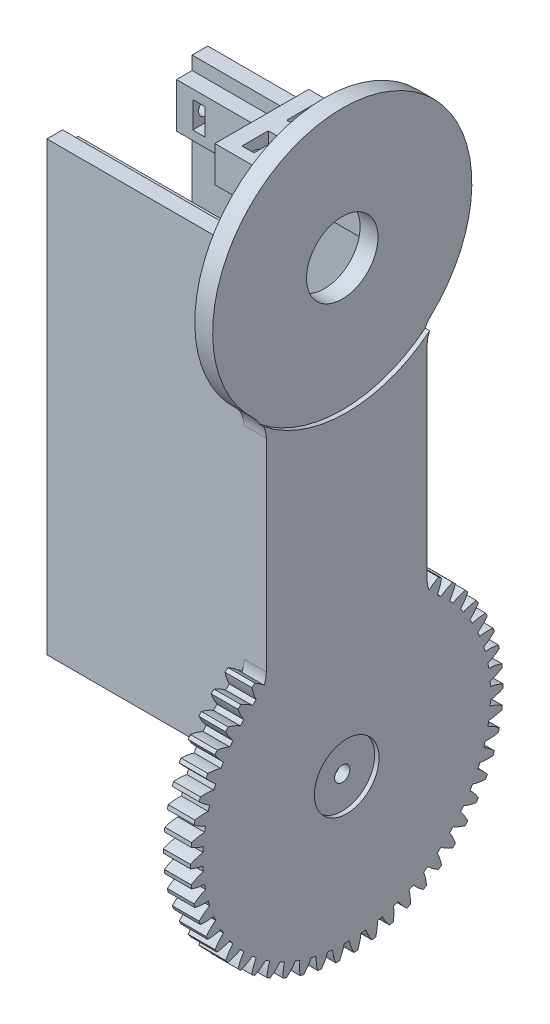
from build123d import *

# Parameters (mm, degrees)
PLATE_START                   = 22.05
SKETCH1_R                     = 8
PLATE_A_DEPTH                 = 5
SHOULDER_START                = 21.05
SHOULDER_GEAR_54T_M1_25_DEPTH = 6
BOX_START                     = -22.05
SKETCH3_W                     = 3.5
SKETCH3_H                     = 100
BOX_WALLS_DEPTH               = 44.3
WALL_START                    = -22.05
SKETCH4_W                     = 3.5
SKETCH4_H                     = 10
WALL_BOSSES_DEPTH             = 44.3
ELBOW_START                   = 8.05
SKETCH5_W                     = 21
SKETCH5_H                     = 8
ELBOW_SERVO_LEDGES_DEPTH      = 14.2
SHOULDER_START_2              = 26.05
SKETCH6_R                     = 7.25
SHOULDER_PIN_SEAT_DEPTH       = 1.2
SHOULDER_START_3              = 20.85
SKETCH7_R                     = 1.7
SHOULDER_PIN_BOLT_DEPTH       = 6.4
SHOULDER_PIN_NUT_DEPTH        = 2.9
ELBOW_START_2                 = 26.05
SKETCH9_R                     = 29.5
ELBOW_HORN_CLEARANCE_DEPTH    = 1.2
COVER_START                   = -22.25
SKETCH10_R                    = 1.7
COVER_BOLT_HOLES_DEPTH        = 10.2
COVER_START_2                 = -18.4
COVER_NUT_SLOTS_DEPTH         = 2.7
TAB_START                     = 7.85
SKETCH12_R                    = 1.7
TAB_BOLT_HOLES_DEPTH          = 9.2
TAB_START_2                   = 11.55
TAB_NUT_SLOTS_DEPTH           = 2.7


with BuildPart() as part:
    # Sketch1 → Plate A (new body)
    with BuildSketch(Plane(origin=(0, 0, 0), x_dir=(0, 0, -1), z_dir=(1, 0, 0)).offset(PLATE_START)):
        with BuildLine():
            Line((-32, 131.68724304), (-32, 177.024521594))
            ThreePointArc((-32, 177.024521594), (-32.49156491, 179.402996496), (-33.885714286, 181.391746464))
            ThreePointArc((-33.885714286, 181.391746464), (-14, 231.5), (5.885714286, 181.391746464))
            ThreePointArc((5.885714286, 181.391746464), (4.49156491, 179.402996496), (4, 177.024521594))
            Line((4, 177.024521594), (4, 131.68724304))
            ThreePointArc((4, 131.68724304), (4.574840835, 129.124500752), (6.189216011, 127.05281477))
            ThreePointArc((6.189216011, 127.05281477), (-14, 70.7125), (-34.189216011, 127.05281477))
            ThreePointArc((-34.189216011, 127.05281477), (-32.574840835, 129.124500752), (-32, 131.68724304))
        make_face()
        with Locations((-14, 202.5)):
            Circle(SKETCH1_R, mode=Mode.SUBTRACT)
    extrude(amount=PLATE_A_DEPTH)

    # Sketch2 → Shoulder gear 54T m1.25 (add)
    with BuildSketch(Plane(origin=(0, 0, 0), x_dir=(0, 0, -1), z_dir=(1, 0, 0)).offset(SHOULDER_START)):
        with BuildLine():
            ThreePointArc((20.99728925, 102.064402541), (21, 102.5), (20.99728925, 102.935597459))
            add(Edge.make_bspline(
                [(20.99728925, 102.935597459), (20.809214363, 103.017845779), (20.436114668, 103.181008569), (19.868047357, 103.392390818), (19.300068691, 103.572479213), (18.73266957, 103.720884072), (18.350257155, 103.78253752), (18.160704764, 103.813097612)],
                knots=[0, 0, 0, 0, 0.206712222, 0.410072118, 0.610077858, 0.806725222, 1, 1, 1, 1], degree=3))
            ThreePointArc((18.160704764, 103.813097612), (18.133043844, 104.371536681), (18.095686912, 104.929411021))
            add(Edge.make_bspline(
                [(18.095686912, 104.929411021), (18.280409808, 104.981770166), (18.653078958, 105.087402107), (19.199412777, 105.300674522), (19.742643988, 105.545483523), (20.282330249, 105.82138507), (20.633965134, 106.026758842), (20.811219879, 106.130285191)],
                knots=[0, 0, 0, 0, 0.193274778, 0.389922142, 0.589927882, 0.793287778, 1, 1, 1, 1], degree=3))
            ThreePointArc((20.811219879, 106.130285191), (20.763342521, 106.563251994), (20.710080322, 106.9955894))
            add(Edge.make_bspline(
                [(20.710080322, 106.9955894), (20.513728683, 107.055447425), (20.12420971, 107.174192736), (19.535443487, 107.318197104), (18.950398302, 107.431129508), (18.369606978, 107.512659888), (17.982622771, 107.529501086), (17.790804255, 107.537848852)],
                knots=[0, 0, 0, 0, 0.206712222, 0.410072118, 0.610077858, 0.806725222, 1, 1, 1, 1], degree=3))
            ThreePointArc((17.790804255, 107.537848852), (17.69849955, 108.089300719), (17.596629954, 108.639066037))
            add(Edge.make_bspline(
                [(17.596629954, 108.639066037), (17.774025294, 108.712516167), (18.131911469, 108.860698111), (18.649791758, 109.13595394), (19.160929243, 109.442172924), (19.664936124, 109.778862674), (19.99035094, 110.023670101), (20.154388476, 110.147074461)],
                knots=[0, 0, 0, 0, 0.193274778, 0.389922142, 0.589927882, 0.793287778, 1, 1, 1, 1], degree=3))
            ThreePointArc((20.154388476, 110.147074461), (20.05657047, 110.571555476), (19.953477102, 110.994786207))
            add(Edge.make_bspline(
                [(19.953477102, 110.994786207), (19.75150403, 111.03144446), (19.350833356, 111.104166464), (18.749330272, 111.17884554), (18.155130302, 111.223094734), (17.568800982, 111.236648078), (17.18247828, 111.208449278), (16.990987656, 111.194471829)],
                knots=[0, 0, 0, 0, 0.206712222, 0.410072118, 0.610077858, 0.806725222, 1, 1, 1, 1], degree=3))
            ThreePointArc((16.990987656, 111.194471829), (16.835287428, 111.731479053), (16.670282779, 112.265700716))
            add(Edge.make_bspline(
                [(16.670282779, 112.265700716), (16.837951596, 112.359248545), (17.176214999, 112.547976585), (17.658638315, 112.881493464), (18.130769818, 113.244981345), (18.59228149, 113.637906147), (18.88707556, 113.918836628), (19.035677561, 114.060450167)],
                knots=[0, 0, 0, 0, 0.193274778, 0.389922142, 0.589927882, 0.793287778, 1, 1, 1, 1], degree=3))
            ThreePointArc((19.035677561, 114.060450167), (18.889241728, 114.470705016), (18.73771135, 114.879105603))
            add(Edge.make_bspline(
                [(18.73771135, 114.879105603), (18.532848185, 114.892068343), (18.126444193, 114.917783602), (17.520338547, 114.922127478), (16.925019326, 114.897095069), (16.341081108, 114.842488091), (15.960644263, 114.769630632), (15.772071112, 114.733516989)],
                knots=[0, 0, 0, 0, 0.206712222, 0.410072118, 0.610077858, 0.806725222, 1, 1, 1, 1], degree=3))
            ThreePointArc((15.772071112, 114.733516989), (15.55508094, 115.248817469), (15.329172645, 115.760271047))
            add(Edge.make_bspline(
                [(15.329172645, 115.760271047), (15.484847505, 115.8726515), (15.798913703, 116.099373412), (16.239356099, 116.486641098), (16.66609685, 116.902482326), (17.07887216, 117.346328546), (17.3390589, 117.659582979), (17.470215779, 117.817490617)],
                knots=[0, 0, 0, 0, 0.193274778, 0.389922142, 0.589927882, 0.793287778, 1, 1, 1, 1], degree=3))
            ThreePointArc((17.470215779, 117.817490617), (17.277142411, 118.207971307), (17.079224214, 118.596018832))
            add(Edge.make_bspline(
                [(17.079224214, 118.596018832), (16.874241378, 118.585110761), (16.467599985, 118.563471518), (15.865088315, 118.497421452), (15.276700516, 118.40344596), (14.703050162, 118.281417125), (14.333643929, 118.164886281), (14.150538381, 118.107124819)],
                knots=[0, 0, 0, 0, 0.206712222, 0.410072118, 0.610077858, 0.806725222, 1, 1, 1, 1], degree=3))
            ThreePointArc((14.150538381, 118.107124819), (13.875192684, 118.59375), (13.591435764, 119.075518959))
            add(Edge.make_bspline(
                [(13.591435764, 119.075518959), (13.733011431, 119.205212284), (14.018633219, 119.466862044), (14.411138467, 119.902643405), (14.78671753, 120.365214441), (15.1451744, 120.85397982), (15.36723523, 121.195321975), (15.479173315, 121.367388283)],
                knots=[0, 0, 0, 0, 0.193274778, 0.389922142, 0.589927882, 0.793287778, 1, 1, 1, 1], degree=3))
            ThreePointArc((15.479173315, 121.367388283), (15.242073399, 121.732814232), (15.000443886, 122.095261019))
            add(Edge.make_bspline(
                [(15.000443886, 122.095261019), (14.79811342, 122.060629649), (14.396733754, 121.991928539), (13.805963997, 121.856377744), (13.232464554, 121.694730027), (12.676859702, 121.506929566), (12.323479667, 121.348301216), (12.14831791, 121.269673059)],
                knots=[0, 0, 0, 0, 0.206712222, 0.410072118, 0.610077858, 0.806725222, 1, 1, 1, 1], degree=3))
            ThreePointArc((12.14831791, 121.269673059), (11.818340267, 121.72104217), (11.480572047, 122.166611412))
            add(Edge.make_bspline(
                [(11.480572047, 122.166611412), (11.606133954, 122.311863729), (11.859448787, 122.604902972), (12.198708926, 123.083304815), (12.518047238, 123.586350178), (12.817338154, 124.113425004), (12.998270083, 124.478238814), (13.089475604, 124.66213689)],
                knots=[0, 0, 0, 0, 0.193274778, 0.389922142, 0.589927882, 0.793287778, 1, 1, 1, 1], degree=3))
            ThreePointArc((13.089475604, 124.66213689), (12.811555509, 124.997566339), (12.529482305, 125.329510915))
            add(Edge.make_bspline(
                [(12.529482305, 125.329510915), (12.332540382, 125.271624577), (11.941850413, 125.156790664), (11.370811717, 124.953572233), (10.819956226, 124.726438298), (10.289910478, 124.47540589), (9.9573355, 124.27682521), (9.792486296, 124.17839367)],
                knots=[0, 0, 0, 0, 0.206712222, 0.410072118, 0.610077858, 0.806725222, 1, 1, 1, 1], degree=3))
            ThreePointArc((9.792486296, 124.17839367), (9.412339088, 124.588402719), (9.025127304, 124.991746684))
            add(Edge.make_bspline(
                [(9.025127304, 124.991746684), (9.132977442, 125.150593705), (9.350559671, 125.471059578), (9.631986791, 125.985612336), (9.890765849, 126.522329203), (10.126843414, 127.080585691), (10.264199648, 127.463937676), (10.333439206, 127.657180613)],
                knots=[0, 0, 0, 0, 0.193274778, 0.389922142, 0.589927882, 0.793287778, 1, 1, 1, 1], degree=3))
            ThreePointArc((10.333439206, 127.657180613), (10.018457325, 127.958077455), (9.699754986, 128.255030841))
            add(Edge.make_bspline(
                [(9.699754986, 128.255030841), (9.510864907, 128.174672347), (9.136148048, 128.015258563), (8.592562731, 127.747120676), (8.071800569, 127.45757212), (7.574481884, 127.146702549), (7.267209469, 126.910855001), (7.11490212, 126.793951196)],
                knots=[0, 0, 0, 0, 0.206712222, 0.410072118, 0.610077858, 0.806725222, 1, 1, 1, 1], degree=3))
            ThreePointArc((7.11490212, 126.793951196), (6.689726187, 127.157055513), (6.258307214, 127.512719666))
            add(Edge.make_bspline(
                [(6.258307214, 127.512719666), (6.346987095, 127.683013257), (6.525894293, 128.02657201), (6.745682574, 128.570317241), (6.940402836, 129.133447435), (7.110074507, 129.715336125), (7.201997537, 130.112042106), (7.248334787, 130.312016626)],
                knots=[0, 0, 0, 0, 0.193274778, 0.389922142, 0.589927882, 0.793287778, 1, 1, 1, 1], degree=3))
            ThreePointArc((7.248334787, 130.312016626), (6.90055071, 130.574311746), (6.549529137, 130.832258156))
            add(Edge.make_bspline(
                [(6.549529137, 130.832258156), (6.371245318, 130.730514219), (6.017568971, 130.528676361), (5.508788092, 130.199245123), (5.025161672, 129.851197594), (4.567295433, 129.484694836), (4.289480914, 129.214769855), (4.151775116, 129.080974707)],
                knots=[0, 0, 0, 0, 0.206712222, 0.410072118, 0.610077858, 0.806725222, 1, 1, 1, 1], degree=3))
            ThreePointArc((4.151775116, 129.080974707), (3.687320232, 129.39226393), (3.217528272, 129.695438523))
            add(Edge.make_bspline(
                [(3.217528272, 129.695438523), (3.285838651, 129.874875755), (3.423651406, 130.236881345), (3.578828589, 130.802465828), (3.706856797, 131.384393979), (3.807828055, 131.982045825), (3.853074782, 132.386741035), (3.87588309, 132.590742825)],
                knots=[0, 0, 0, 0, 0.193274778, 0.389922142, 0.589927882, 0.793287778, 1, 1, 1, 1], degree=3))
            ThreePointArc((3.87588309, 132.590742825), (3.5, 132.810889132), (3.12140616, 133.026340284))
            add(Edge.make_bspline(
                [(3.12140616, 133.026340284), (2.956139581, 132.904586814), (2.628286612, 132.663054394), (2.16119056, 132.276784797), (1.721240102, 131.874945041), (1.309018164, 131.457765417), (1.064418504, 131.157413276), (0.943176492, 131.008536135)],
                knots=[0, 0, 0, 0, 0.206712222, 0.410072118, 0.610077858, 0.806725222, 1, 1, 1, 1], degree=3))
            ThreePointArc((0.943176492, 131.008536135), (0.445723613, 131.26380061), (-0.056088204, 131.510385728))
            add(Edge.make_bspline(
                [(-0.056088204, 131.510385728), (-0.009071106, 131.696540021), (0.085783524, 132.072096943), (0.174251104, 132.651872116), (0.233855896, 133.244728646), (0.264761278, 133.850061431), (0.262719816, 134.257273061), (0.261690741, 134.462543347)],
                knots=[0, 0, 0, 0, 0.193274778, 0.389922142, 0.589927882, 0.793287778, 1, 1, 1, 1], degree=3))
            ThreePointArc((0.261690741, 134.462543347), (-0.137208189, 134.637563741), (-0.538254465, 134.807606026))
            add(Edge.make_bspline(
                [(-0.538254465, 134.807606026), (-0.688268854, 134.667489531), (-0.985864797, 134.389528861), (-1.404959349, 133.951644538), (-1.795284272, 133.501446748), (-2.156287314, 133.039231898), (-2.364364323, 132.712514343), (-2.467502959, 132.550568518)],
                knots=[0, 0, 0, 0, 0.206712222, 0.410072118, 0.610077858, 0.806725222, 1, 1, 1, 1], degree=3))
            ThreePointArc((-2.467502959, 132.550568518), (-2.991226637, 132.746356232), (-3.518272166, 132.933017232))
            add(Edge.make_bspline(
                [(-3.518272166, 132.933017232), (-3.493184175, 133.123371169), (-3.442570416, 133.507400659), (-3.422008811, 134.09352606), (-3.431633488, 134.6892936), (-3.471211924, 135.294121237), (-3.520513967, 135.698342448), (-3.54536651, 135.902105302)],
                knots=[0, 0, 0, 0, 0.193274778, 0.389922142, 0.589927882, 0.793287778, 1, 1, 1, 1], degree=3))
            ThreePointArc((-3.54536651, 135.902105302), (-3.961886855, 136.029632931), (-4.379962104, 136.15196682))
            add(Edge.make_bspline(
                [(-4.379962104, 136.15196682), (-4.512695618, 135.995382135), (-4.776010059, 135.684752156), (-5.141435577, 135.201174742), (-5.476856489, 134.708707071), (-5.781758689, 134.207707657), (-5.950499162, 133.859042982), (-6.034139648, 133.686218513)],
                knots=[0, 0, 0, 0, 0.206712222, 0.410072118, 0.610077858, 0.806725222, 1, 1, 1, 1], degree=3))
            ThreePointArc((-6.034139648, 133.686218513), (-6.57705166, 133.819881772), (-7.122203516, 133.944094386))
            add(Edge.make_bspline(
                [(-7.122203516, 133.944094386), (-7.119383905, 134.136073755), (-7.11369548, 134.523382475), (-7.161317911, 135.107931762), (-7.240041899, 135.698553578), (-7.349568923, 136.294696811), (-7.445464821, 136.690461205), (-7.493804744, 136.889961083)],
                knots=[0, 0, 0, 0, 0.193274778, 0.389922142, 0.589927882, 0.793287778, 1, 1, 1, 1], degree=3))
            ThreePointArc((-7.493804744, 136.889961083), (-7.922313782, 136.968271355), (-8.351764253, 137.041242493))
            add(Edge.make_bspline(
                [(-8.351764253, 137.041242493), (-8.465421898, 136.870307157), (-8.690893961, 136.531208605), (-8.997708691, 136.008477656), (-9.2736896, 135.480399884), (-9.518367679, 134.947391063), (-9.645489691, 134.581494362), (-9.708500934, 134.400128401)],
                knots=[0, 0, 0, 0, 0.206712222, 0.410072118, 0.610077858, 0.806725222, 1, 1, 1, 1], degree=3))
            ThreePointArc((-9.708500934, 134.400128401), (-10.263259327, 134.46985964), (-10.819145265, 134.529944106))
            add(Edge.make_bspline(
                [(-10.819145265, 134.529944106), (-10.838632163, 134.720952716), (-10.877945999, 135.106302978), (-10.993108455, 135.681371125), (-11.139867147, 136.25886007), (-11.317861594, 136.838257085), (-11.45905452, 137.220212628), (-11.530228107, 137.412751636)],
                knots=[0, 0, 0, 0, 0.193274778, 0.389922142, 0.589927882, 0.793287778, 1, 1, 1, 1], degree=3))
            ThreePointArc((-11.530228107, 137.412751636), (-11.964930988, 137.440785539), (-12.399949101, 137.463407115))
            add(Edge.make_bspline(
                [(-12.399949101, 137.463407115), (-12.492993853, 137.280432736), (-12.677574415, 136.917451338), (-12.921629215, 136.362635893), (-13.134437952, 135.806089366), (-13.315583057, 135.248279169), (-13.399367502, 134.870098565), (-13.440897383, 134.682643778)],
                knots=[0, 0, 0, 0, 0.206712222, 0.410072118, 0.610077858, 0.806725222, 1, 1, 1, 1], degree=3))
            ThreePointArc((-13.440897383, 134.682643778), (-14, 134.6875), (-14.559102617, 134.682643778))
            add(Edge.make_bspline(
                [(-14.559102617, 134.682643778), (-14.600632498, 134.870098565), (-14.684416943, 135.248279169), (-14.865562048, 135.806089366), (-15.078370785, 136.362635893), (-15.322425585, 136.917451338), (-15.507006147, 137.280432736), (-15.600050899, 137.463407115)],
                knots=[0, 0, 0, 0, 0.193274778, 0.389922142, 0.589927882, 0.793287778, 1, 1, 1, 1], degree=3))
            ThreePointArc((-15.600050899, 137.463407115), (-16.035069012, 137.440785539), (-16.469771893, 137.412751636))
            add(Edge.make_bspline(
                [(-16.469771893, 137.412751636), (-16.54094548, 137.220212628), (-16.682138406, 136.838257085), (-16.860132853, 136.25886007), (-17.006891545, 135.681371125), (-17.122054001, 135.106302978), (-17.161367837, 134.720952716), (-17.180854735, 134.529944106)],
                knots=[0, 0, 0, 0, 0.206712222, 0.410072118, 0.610077858, 0.806725222, 1, 1, 1, 1], degree=3))
            ThreePointArc((-17.180854735, 134.529944106), (-17.736740673, 134.46985964), (-18.291499066, 134.400128401))
            add(Edge.make_bspline(
                [(-18.291499066, 134.400128401), (-18.354510309, 134.581494362), (-18.481632321, 134.947391063), (-18.7263104, 135.480399884), (-19.002291309, 136.008477656), (-19.309106039, 136.531208605), (-19.534578102, 136.870307157), (-19.648235747, 137.041242493)],
                knots=[0, 0, 0, 0, 0.193274778, 0.389922142, 0.589927882, 0.793287778, 1, 1, 1, 1], degree=3))
            ThreePointArc((-19.648235747, 137.041242493), (-20.077686218, 136.968271355), (-20.506195256, 136.889961083))
            add(Edge.make_bspline(
                [(-20.506195256, 136.889961083), (-20.554535179, 136.690461205), (-20.650431077, 136.294696811), (-20.759958101, 135.698553578), (-20.838682089, 135.107931762), (-20.88630452, 134.523382475), (-20.880616095, 134.136073755), (-20.877796484, 133.944094386)],
                knots=[0, 0, 0, 0, 0.206712222, 0.410072118, 0.610077858, 0.806725222, 1, 1, 1, 1], degree=3))
            ThreePointArc((-20.877796484, 133.944094386), (-21.42294834, 133.819881772), (-21.965860352, 133.686218513))
            add(Edge.make_bspline(
                [(-21.965860352, 133.686218513), (-22.049500838, 133.859042982), (-22.218241311, 134.207707657), (-22.523143511, 134.708707071), (-22.858564423, 135.201174742), (-23.223989941, 135.684752156), (-23.487304382, 135.995382135), (-23.620037896, 136.15196682)],
                knots=[0, 0, 0, 0, 0.193274778, 0.389922142, 0.589927882, 0.793287778, 1, 1, 1, 1], degree=3))
            ThreePointArc((-23.620037896, 136.15196682), (-24.038113145, 136.029632931), (-24.45463349, 135.902105302))
            add(Edge.make_bspline(
                [(-24.45463349, 135.902105302), (-24.479486033, 135.698342448), (-24.528788076, 135.294121237), (-24.568366512, 134.6892936), (-24.577991189, 134.09352606), (-24.557429584, 133.507400659), (-24.506815825, 133.123371169), (-24.481727834, 132.933017232)],
                knots=[0, 0, 0, 0, 0.206712222, 0.410072118, 0.610077858, 0.806725222, 1, 1, 1, 1], degree=3))
            ThreePointArc((-24.481727834, 132.933017232), (-25.008773363, 132.746356232), (-25.532497041, 132.550568518))
            add(Edge.make_bspline(
                [(-25.532497041, 132.550568518), (-25.635635677, 132.712514343), (-25.843712686, 133.039231898), (-26.204715728, 133.501446748), (-26.595040651, 133.951644538), (-27.014135203, 134.389528861), (-27.311731146, 134.667489531), (-27.461745535, 134.807606026)],
                knots=[0, 0, 0, 0, 0.193274778, 0.389922142, 0.589927882, 0.793287778, 1, 1, 1, 1], degree=3))
            ThreePointArc((-27.461745535, 134.807606026), (-27.862791811, 134.637563741), (-28.261690741, 134.462543347))
            add(Edge.make_bspline(
                [(-28.261690741, 134.462543347), (-28.262719816, 134.257273061), (-28.264761278, 133.850061431), (-28.233855896, 133.244728646), (-28.174251104, 132.651872116), (-28.085783524, 132.072096943), (-27.990928894, 131.696540021), (-27.943911796, 131.510385728)],
                knots=[0, 0, 0, 0, 0.206712222, 0.410072118, 0.610077858, 0.806725222, 1, 1, 1, 1], degree=3))
            ThreePointArc((-27.943911796, 131.510385728), (-28.445723613, 131.26380061), (-28.943176492, 131.008536135))
            add(Edge.make_bspline(
                [(-28.943176492, 131.008536135), (-29.064418504, 131.157413276), (-29.309018164, 131.457765417), (-29.721240102, 131.874945041), (-30.16119056, 132.276784797), (-30.628286612, 132.663054394), (-30.956139581, 132.904586814), (-31.12140616, 133.026340284)],
                knots=[0, 0, 0, 0, 0.193274778, 0.389922142, 0.589927882, 0.793287778, 1, 1, 1, 1], degree=3))
            ThreePointArc((-31.12140616, 133.026340284), (-31.5, 132.810889132), (-31.87588309, 132.590742825))
            add(Edge.make_bspline(
                [(-31.87588309, 132.590742825), (-31.853074782, 132.386741035), (-31.807828055, 131.982045825), (-31.706856797, 131.384393979), (-31.578828589, 130.802465828), (-31.423651406, 130.236881345), (-31.285838651, 129.874875755), (-31.217528272, 129.695438523)],
                knots=[0, 0, 0, 0, 0.206712222, 0.410072118, 0.610077858, 0.806725222, 1, 1, 1, 1], degree=3))
            ThreePointArc((-31.217528272, 129.695438523), (-31.687320232, 129.39226393), (-32.151775116, 129.080974707))
            add(Edge.make_bspline(
                [(-32.151775116, 129.080974707), (-32.289480914, 129.214769855), (-32.567295433, 129.484694836), (-33.025161672, 129.851197594), (-33.508788092, 130.199245123), (-34.017568971, 130.528676361), (-34.371245318, 130.730514219), (-34.549529137, 130.832258156)],
                knots=[0, 0, 0, 0, 0.193274778, 0.389922142, 0.589927882, 0.793287778, 1, 1, 1, 1], degree=3))
            ThreePointArc((-34.549529137, 130.832258156), (-34.90055071, 130.574311746), (-35.248334787, 130.312016626))
            add(Edge.make_bspline(
                [(-35.248334787, 130.312016626), (-35.201997537, 130.112042106), (-35.110074507, 129.715336125), (-34.940402836, 129.133447435), (-34.745682574, 128.570317241), (-34.525894293, 128.02657201), (-34.346987095, 127.683013257), (-34.258307214, 127.512719666)],
                knots=[0, 0, 0, 0, 0.206712222, 0.410072118, 0.610077858, 0.806725222, 1, 1, 1, 1], degree=3))
            ThreePointArc((-34.258307214, 127.512719666), (-34.689726187, 127.157055513), (-35.11490212, 126.793951196))
            add(Edge.make_bspline(
                [(-35.11490212, 126.793951196), (-35.267209469, 126.910855001), (-35.574481884, 127.146702549), (-36.071800569, 127.45757212), (-36.592562731, 127.747120676), (-37.136148048, 128.015258563), (-37.510864907, 128.174672347), (-37.699754986, 128.255030841)],
                knots=[0, 0, 0, 0, 0.193274778, 0.389922142, 0.589927882, 0.793287778, 1, 1, 1, 1], degree=3))
            ThreePointArc((-37.699754986, 128.255030841), (-38.018457325, 127.958077455), (-38.333439206, 127.657180613))
            add(Edge.make_bspline(
                [(-38.333439206, 127.657180613), (-38.264199648, 127.463937676), (-38.126843414, 127.080585691), (-37.890765849, 126.522329203), (-37.631986791, 125.985612336), (-37.350559671, 125.471059578), (-37.132977442, 125.150593705), (-37.025127304, 124.991746684)],
                knots=[0, 0, 0, 0, 0.206712222, 0.410072118, 0.610077858, 0.806725222, 1, 1, 1, 1], degree=3))
            ThreePointArc((-37.025127304, 124.991746684), (-37.412339088, 124.588402719), (-37.792486296, 124.17839367))
            add(Edge.make_bspline(
                [(-37.792486296, 124.17839367), (-37.9573355, 124.27682521), (-38.289910478, 124.47540589), (-38.819956226, 124.726438298), (-39.370811717, 124.953572233), (-39.941850413, 125.156790664), (-40.332540382, 125.271624577), (-40.529482305, 125.329510915)],
                knots=[0, 0, 0, 0, 0.193274778, 0.389922142, 0.589927882, 0.793287778, 1, 1, 1, 1], degree=3))
            ThreePointArc((-40.529482305, 125.329510915), (-40.811555509, 124.997566339), (-41.089475604, 124.66213689))
            add(Edge.make_bspline(
                [(-41.089475604, 124.66213689), (-40.998270083, 124.478238814), (-40.817338154, 124.113425004), (-40.518047238, 123.586350178), (-40.198708926, 123.083304815), (-39.859448787, 122.604902972), (-39.606133954, 122.311863729), (-39.480572047, 122.166611412)],
                knots=[0, 0, 0, 0, 0.206712222, 0.410072118, 0.610077858, 0.806725222, 1, 1, 1, 1], degree=3))
            ThreePointArc((-39.480572047, 122.166611412), (-39.818340267, 121.72104217), (-40.14831791, 121.269673059))
            add(Edge.make_bspline(
                [(-40.14831791, 121.269673059), (-40.323479667, 121.348301216), (-40.676859702, 121.506929566), (-41.232464554, 121.694730027), (-41.805963997, 121.856377744), (-42.396733754, 121.991928539), (-42.79811342, 122.060629649), (-43.000443886, 122.095261019)],
                knots=[0, 0, 0, 0, 0.193274778, 0.389922142, 0.589927882, 0.793287778, 1, 1, 1, 1], degree=3))
            ThreePointArc((-43.000443886, 122.095261019), (-43.242073399, 121.732814232), (-43.479173315, 121.367388283))
            add(Edge.make_bspline(
                [(-43.479173315, 121.367388283), (-43.36723523, 121.195321975), (-43.1451744, 120.85397982), (-42.78671753, 120.365214441), (-42.411138467, 119.902643405), (-42.018633219, 119.466862044), (-41.733011431, 119.205212284), (-41.591435764, 119.075518959)],
                knots=[0, 0, 0, 0, 0.206712222, 0.410072118, 0.610077858, 0.806725222, 1, 1, 1, 1], degree=3))
            ThreePointArc((-41.591435764, 119.075518959), (-41.875192684, 118.59375), (-42.150538381, 118.107124819))
            add(Edge.make_bspline(
                [(-42.150538381, 118.107124819), (-42.333643929, 118.164886281), (-42.703050162, 118.281417125), (-43.276700516, 118.40344596), (-43.865088315, 118.497421452), (-44.467599985, 118.563471518), (-44.874241378, 118.585110761), (-45.079224214, 118.596018832)],
                knots=[0, 0, 0, 0, 0.193274778, 0.389922142, 0.589927882, 0.793287778, 1, 1, 1, 1], degree=3))
            ThreePointArc((-45.079224214, 118.596018832), (-45.277142411, 118.207971307), (-45.470215779, 117.817490617))
            add(Edge.make_bspline(
                [(-45.470215779, 117.817490617), (-45.3390589, 117.659582979), (-45.07887216, 117.346328546), (-44.66609685, 116.902482326), (-44.239356099, 116.486641098), (-43.798913703, 116.099373412), (-43.484847505, 115.8726515), (-43.329172645, 115.760271047)],
                knots=[0, 0, 0, 0, 0.206712222, 0.410072118, 0.610077858, 0.806725222, 1, 1, 1, 1], degree=3))
            ThreePointArc((-43.329172645, 115.760271047), (-43.55508094, 115.248817469), (-43.772071112, 114.733516989))
            add(Edge.make_bspline(
                [(-43.772071112, 114.733516989), (-43.960644263, 114.769630632), (-44.341081108, 114.842488091), (-44.925019326, 114.897095069), (-45.520338547, 114.922127478), (-46.126444193, 114.917783602), (-46.532848185, 114.892068343), (-46.73771135, 114.879105603)],
                knots=[0, 0, 0, 0, 0.193274778, 0.389922142, 0.589927882, 0.793287778, 1, 1, 1, 1], degree=3))
            ThreePointArc((-46.73771135, 114.879105603), (-46.889241728, 114.470705016), (-47.035677561, 114.060450167))
            add(Edge.make_bspline(
                [(-47.035677561, 114.060450167), (-46.88707556, 113.918836628), (-46.59228149, 113.637906147), (-46.130769818, 113.244981345), (-45.658638315, 112.881493464), (-45.176214999, 112.547976585), (-44.837951596, 112.359248545), (-44.670282779, 112.265700716)],
                knots=[0, 0, 0, 0, 0.206712222, 0.410072118, 0.610077858, 0.806725222, 1, 1, 1, 1], degree=3))
            ThreePointArc((-44.670282779, 112.265700716), (-44.835287428, 111.731479053), (-44.990987656, 111.194471829))
            add(Edge.make_bspline(
                [(-44.990987656, 111.194471829), (-45.18247828, 111.208449278), (-45.568800982, 111.236648078), (-46.155130302, 111.223094734), (-46.749330272, 111.17884554), (-47.350833356, 111.104166464), (-47.75150403, 111.03144446), (-47.953477102, 110.994786207)],
                knots=[0, 0, 0, 0, 0.193274778, 0.389922142, 0.589927882, 0.793287778, 1, 1, 1, 1], degree=3))
            ThreePointArc((-47.953477102, 110.994786207), (-48.05657047, 110.571555476), (-48.154388476, 110.147074461))
            add(Edge.make_bspline(
                [(-48.154388476, 110.147074461), (-47.99035094, 110.023670101), (-47.664936124, 109.778862674), (-47.160929243, 109.442172924), (-46.649791758, 109.13595394), (-46.131911469, 108.860698111), (-45.774025294, 108.712516167), (-45.596629954, 108.639066037)],
                knots=[0, 0, 0, 0, 0.206712222, 0.410072118, 0.610077858, 0.806725222, 1, 1, 1, 1], degree=3))
            ThreePointArc((-45.596629954, 108.639066037), (-45.69849955, 108.089300719), (-45.790804255, 107.537848852))
            add(Edge.make_bspline(
                [(-45.790804255, 107.537848852), (-45.982622771, 107.529501086), (-46.369606978, 107.512659888), (-46.950398302, 107.431129508), (-47.535443487, 107.318197104), (-48.12420971, 107.174192736), (-48.513728683, 107.055447425), (-48.710080322, 106.9955894)],
                knots=[0, 0, 0, 0, 0.193274778, 0.389922142, 0.589927882, 0.793287778, 1, 1, 1, 1], degree=3))
            ThreePointArc((-48.710080322, 106.9955894), (-48.763342521, 106.563251994), (-48.811219879, 106.130285191))
            add(Edge.make_bspline(
                [(-48.811219879, 106.130285191), (-48.633965134, 106.026758842), (-48.282330249, 105.82138507), (-47.742643988, 105.545483523), (-47.199412777, 105.300674522), (-46.653078958, 105.087402107), (-46.280409808, 104.981770166), (-46.095686912, 104.929411021)],
                knots=[0, 0, 0, 0, 0.206712222, 0.410072118, 0.610077858, 0.806725222, 1, 1, 1, 1], degree=3))
            ThreePointArc((-46.095686912, 104.929411021), (-46.133043844, 104.371536681), (-46.160704764, 103.813097612))
            add(Edge.make_bspline(
                [(-46.160704764, 103.813097612), (-46.350257155, 103.78253752), (-46.73266957, 103.720884072), (-47.300068691, 103.572479213), (-47.868047357, 103.392390818), (-48.436114668, 103.181008569), (-48.809214363, 103.017845779), (-48.99728925, 102.935597459)],
                knots=[0, 0, 0, 0, 0.193274778, 0.389922142, 0.589927882, 0.793287778, 1, 1, 1, 1], degree=3))
            ThreePointArc((-48.99728925, 102.935597459), (-49, 102.5), (-48.99728925, 102.064402541))
            add(Edge.make_bspline(
                [(-48.99728925, 102.064402541), (-48.809214363, 101.982154221), (-48.436114668, 101.818991431), (-47.868047357, 101.607609182), (-47.300068691, 101.427520787), (-46.73266957, 101.279115928), (-46.350257155, 101.21746248), (-46.160704764, 101.186902388)],
                knots=[0, 0, 0, 0, 0.206712222, 0.410072118, 0.610077858, 0.806725222, 1, 1, 1, 1], degree=3))
            ThreePointArc((-46.160704764, 101.186902388), (-46.133043844, 100.628463319), (-46.095686912, 100.070588979))
            add(Edge.make_bspline(
                [(-46.095686912, 100.070588979), (-46.280409808, 100.018229834), (-46.653078958, 99.912597893), (-47.199412777, 99.699325478), (-47.742643988, 99.454516477), (-48.282330249, 99.17861493), (-48.633965134, 98.973241158), (-48.811219879, 98.869714809)],
                knots=[0, 0, 0, 0, 0.193274778, 0.389922142, 0.589927882, 0.793287778, 1, 1, 1, 1], degree=3))
            ThreePointArc((-48.811219879, 98.869714809), (-48.763342521, 98.436748006), (-48.710080322, 98.0044106))
            add(Edge.make_bspline(
                [(-48.710080322, 98.0044106), (-48.513728683, 97.944552575), (-48.12420971, 97.825807264), (-47.535443487, 97.681802896), (-46.950398302, 97.568870492), (-46.369606978, 97.487340112), (-45.982622771, 97.470498914), (-45.790804255, 97.462151148)],
                knots=[0, 0, 0, 0, 0.206712222, 0.410072118, 0.610077858, 0.806725222, 1, 1, 1, 1], degree=3))
            ThreePointArc((-45.790804255, 97.462151148), (-45.69849955, 96.910699281), (-45.596629954, 96.360933963))
            add(Edge.make_bspline(
                [(-45.596629954, 96.360933963), (-45.774025294, 96.287483833), (-46.131911469, 96.139301889), (-46.649791758, 95.86404606), (-47.160929243, 95.557827076), (-47.664936124, 95.221137326), (-47.99035094, 94.976329899), (-48.154388476, 94.852925539)],
                knots=[0, 0, 0, 0, 0.193274778, 0.389922142, 0.589927882, 0.793287778, 1, 1, 1, 1], degree=3))
            ThreePointArc((-48.154388476, 94.852925539), (-48.05657047, 94.428444524), (-47.953477102, 94.005213793))
            add(Edge.make_bspline(
                [(-47.953477102, 94.005213793), (-47.75150403, 93.96855554), (-47.350833356, 93.895833536), (-46.749330272, 93.82115446), (-46.155130302, 93.776905266), (-45.568800982, 93.763351922), (-45.18247828, 93.791550722), (-44.990987656, 93.805528171)],
                knots=[0, 0, 0, 0, 0.206712222, 0.410072118, 0.610077858, 0.806725222, 1, 1, 1, 1], degree=3))
            ThreePointArc((-44.990987656, 93.805528171), (-44.835287428, 93.268520947), (-44.670282779, 92.734299284))
            add(Edge.make_bspline(
                [(-44.670282779, 92.734299284), (-44.837951596, 92.640751455), (-45.176214999, 92.452023415), (-45.658638315, 92.118506536), (-46.130769818, 91.755018655), (-46.59228149, 91.362093853), (-46.88707556, 91.081163372), (-47.035677561, 90.939549833)],
                knots=[0, 0, 0, 0, 0.193274778, 0.389922142, 0.589927882, 0.793287778, 1, 1, 1, 1], degree=3))
            ThreePointArc((-47.035677561, 90.939549833), (-46.889241728, 90.529294984), (-46.73771135, 90.120894397))
            add(Edge.make_bspline(
                [(-46.73771135, 90.120894397), (-46.532848185, 90.107931657), (-46.126444193, 90.082216398), (-45.520338547, 90.077872522), (-44.925019326, 90.102904931), (-44.341081108, 90.157511909), (-43.960644263, 90.230369368), (-43.772071112, 90.266483011)],
                knots=[0, 0, 0, 0, 0.206712222, 0.410072118, 0.610077858, 0.806725222, 1, 1, 1, 1], degree=3))
            ThreePointArc((-43.772071112, 90.266483011), (-43.55508094, 89.751182531), (-43.329172645, 89.239728953))
            add(Edge.make_bspline(
                [(-43.329172645, 89.239728953), (-43.484847505, 89.1273485), (-43.798913703, 88.900626588), (-44.239356099, 88.513358902), (-44.66609685, 88.097517674), (-45.07887216, 87.653671454), (-45.3390589, 87.340417021), (-45.470215779, 87.182509383)],
                knots=[0, 0, 0, 0, 0.193274778, 0.389922142, 0.589927882, 0.793287778, 1, 1, 1, 1], degree=3))
            ThreePointArc((-45.470215779, 87.182509383), (-45.277142411, 86.792028693), (-45.079224214, 86.403981168))
            add(Edge.make_bspline(
                [(-45.079224214, 86.403981168), (-44.874241378, 86.414889239), (-44.467599985, 86.436528482), (-43.865088315, 86.502578548), (-43.276700516, 86.59655404), (-42.703050162, 86.718582875), (-42.333643929, 86.835113719), (-42.150538381, 86.892875181)],
                knots=[0, 0, 0, 0, 0.206712222, 0.410072118, 0.610077858, 0.806725222, 1, 1, 1, 1], degree=3))
            ThreePointArc((-42.150538381, 86.892875181), (-41.875192684, 86.40625), (-41.591435764, 85.924481041))
            add(Edge.make_bspline(
                [(-41.591435764, 85.924481041), (-41.733011431, 85.794787716), (-42.018633219, 85.533137956), (-42.411138467, 85.097356595), (-42.78671753, 84.634785559), (-43.1451744, 84.14602018), (-43.36723523, 83.804678025), (-43.479173315, 83.632611717)],
                knots=[0, 0, 0, 0, 0.193274778, 0.389922142, 0.589927882, 0.793287778, 1, 1, 1, 1], degree=3))
            ThreePointArc((-43.479173315, 83.632611717), (-43.242073399, 83.267185768), (-43.000443886, 82.904738981))
            add(Edge.make_bspline(
                [(-43.000443886, 82.904738981), (-42.79811342, 82.939370351), (-42.396733754, 83.008071461), (-41.805963997, 83.143622256), (-41.232464554, 83.305269973), (-40.676859702, 83.493070434), (-40.323479667, 83.651698784), (-40.14831791, 83.730326941)],
                knots=[0, 0, 0, 0, 0.206712222, 0.410072118, 0.610077858, 0.806725222, 1, 1, 1, 1], degree=3))
            ThreePointArc((-40.14831791, 83.730326941), (-39.818340267, 83.27895783), (-39.480572047, 82.833388588))
            add(Edge.make_bspline(
                [(-39.480572047, 82.833388588), (-39.606133954, 82.688136271), (-39.859448787, 82.395097028), (-40.198708926, 81.916695185), (-40.518047238, 81.413649822), (-40.817338154, 80.886574996), (-40.998270083, 80.521761186), (-41.089475604, 80.33786311)],
                knots=[0, 0, 0, 0, 0.193274778, 0.389922142, 0.589927882, 0.793287778, 1, 1, 1, 1], degree=3))
            ThreePointArc((-41.089475604, 80.33786311), (-40.811555509, 80.002433661), (-40.529482305, 79.670489085))
            add(Edge.make_bspline(
                [(-40.529482305, 79.670489085), (-40.332540382, 79.728375423), (-39.941850413, 79.843209336), (-39.370811717, 80.046427767), (-38.819956226, 80.273561702), (-38.289910478, 80.52459411), (-37.9573355, 80.72317479), (-37.792486296, 80.82160633)],
                knots=[0, 0, 0, 0, 0.206712222, 0.410072118, 0.610077858, 0.806725222, 1, 1, 1, 1], degree=3))
            ThreePointArc((-37.792486296, 80.82160633), (-37.412339088, 80.411597281), (-37.025127304, 80.008253316))
            add(Edge.make_bspline(
                [(-37.025127304, 80.008253316), (-37.132977442, 79.849406295), (-37.350559671, 79.528940422), (-37.631986791, 79.014387664), (-37.890765849, 78.477670797), (-38.126843414, 77.919414309), (-38.264199648, 77.536062324), (-38.333439206, 77.342819387)],
                knots=[0, 0, 0, 0, 0.193274778, 0.389922142, 0.589927882, 0.793287778, 1, 1, 1, 1], degree=3))
            ThreePointArc((-38.333439206, 77.342819387), (-38.018457325, 77.041922545), (-37.699754986, 76.744969159))
            add(Edge.make_bspline(
                [(-37.699754986, 76.744969159), (-37.510864907, 76.825327653), (-37.136148048, 76.984741437), (-36.592562731, 77.252879324), (-36.071800569, 77.54242788), (-35.574481884, 77.853297451), (-35.267209469, 78.089144999), (-35.11490212, 78.206048804)],
                knots=[0, 0, 0, 0, 0.206712222, 0.410072118, 0.610077858, 0.806725222, 1, 1, 1, 1], degree=3))
            ThreePointArc((-35.11490212, 78.206048804), (-34.689726187, 77.842944487), (-34.258307214, 77.487280334))
            add(Edge.make_bspline(
                [(-34.258307214, 77.487280334), (-34.346987095, 77.316986743), (-34.525894293, 76.97342799), (-34.745682574, 76.429682759), (-34.940402836, 75.866552565), (-35.110074507, 75.284663875), (-35.201997537, 74.887957894), (-35.248334787, 74.687983374)],
                knots=[0, 0, 0, 0, 0.193274778, 0.389922142, 0.589927882, 0.793287778, 1, 1, 1, 1], degree=3))
            ThreePointArc((-35.248334787, 74.687983374), (-34.90055071, 74.425688254), (-34.549529137, 74.167741844))
            add(Edge.make_bspline(
                [(-34.549529137, 74.167741844), (-34.371245318, 74.269485781), (-34.017568971, 74.471323639), (-33.508788092, 74.800754877), (-33.025161672, 75.148802406), (-32.567295433, 75.515305164), (-32.289480914, 75.785230145), (-32.151775116, 75.919025293)],
                knots=[0, 0, 0, 0, 0.206712222, 0.410072118, 0.610077858, 0.806725222, 1, 1, 1, 1], degree=3))
            ThreePointArc((-32.151775116, 75.919025293), (-31.687320232, 75.60773607), (-31.217528272, 75.304561477))
            add(Edge.make_bspline(
                [(-31.217528272, 75.304561477), (-31.285838651, 75.125124245), (-31.423651406, 74.763118655), (-31.578828589, 74.197534172), (-31.706856797, 73.615606021), (-31.807828055, 73.017954175), (-31.853074782, 72.613258965), (-31.87588309, 72.409257175)],
                knots=[0, 0, 0, 0, 0.193274778, 0.389922142, 0.589927882, 0.793287778, 1, 1, 1, 1], degree=3))
            ThreePointArc((-31.87588309, 72.409257175), (-31.5, 72.189110868), (-31.12140616, 71.973659716))
            add(Edge.make_bspline(
                [(-31.12140616, 71.973659716), (-30.956139581, 72.095413186), (-30.628286612, 72.336945606), (-30.16119056, 72.723215203), (-29.721240102, 73.125054959), (-29.309018164, 73.542234583), (-29.064418504, 73.842586724), (-28.943176492, 73.991463865)],
                knots=[0, 0, 0, 0, 0.206712222, 0.410072118, 0.610077858, 0.806725222, 1, 1, 1, 1], degree=3))
            ThreePointArc((-28.943176492, 73.991463865), (-28.445723613, 73.73619939), (-27.943911796, 73.489614272))
            add(Edge.make_bspline(
                [(-27.943911796, 73.489614272), (-27.990928894, 73.303459979), (-28.085783524, 72.927903057), (-28.174251104, 72.348127884), (-28.233855896, 71.755271354), (-28.264761278, 71.149938569), (-28.262719816, 70.742726939), (-28.261690741, 70.537456653)],
                knots=[0, 0, 0, 0, 0.193274778, 0.389922142, 0.589927882, 0.793287778, 1, 1, 1, 1], degree=3))
            ThreePointArc((-28.261690741, 70.537456653), (-27.862791811, 70.362436259), (-27.461745535, 70.192393974))
            add(Edge.make_bspline(
                [(-27.461745535, 70.192393974), (-27.311731146, 70.332510469), (-27.014135203, 70.610471139), (-26.595040651, 71.048355462), (-26.204715728, 71.498553252), (-25.843712686, 71.960768102), (-25.635635677, 72.287485657), (-25.532497041, 72.449431482)],
                knots=[0, 0, 0, 0, 0.206712222, 0.410072118, 0.610077858, 0.806725222, 1, 1, 1, 1], degree=3))
            ThreePointArc((-25.532497041, 72.449431482), (-25.008773363, 72.253643768), (-24.481727834, 72.066982768))
            add(Edge.make_bspline(
                [(-24.481727834, 72.066982768), (-24.506815825, 71.876628831), (-24.557429584, 71.492599341), (-24.577991189, 70.90647394), (-24.568366512, 70.3107064), (-24.528788076, 69.705878763), (-24.479486033, 69.301657552), (-24.45463349, 69.097894698)],
                knots=[0, 0, 0, 0, 0.193274778, 0.389922142, 0.589927882, 0.793287778, 1, 1, 1, 1], degree=3))
            ThreePointArc((-24.45463349, 69.097894698), (-24.038113145, 68.970367069), (-23.620037896, 68.84803318))
            add(Edge.make_bspline(
                [(-23.620037896, 68.84803318), (-23.487304382, 69.004617865), (-23.223989941, 69.315247844), (-22.858564423, 69.798825258), (-22.523143511, 70.291292929), (-22.218241311, 70.792292343), (-22.049500838, 71.140957018), (-21.965860352, 71.313781487)],
                knots=[0, 0, 0, 0, 0.206712222, 0.410072118, 0.610077858, 0.806725222, 1, 1, 1, 1], degree=3))
            ThreePointArc((-21.965860352, 71.313781487), (-21.42294834, 71.180118228), (-20.877796484, 71.055905614))
            add(Edge.make_bspline(
                [(-20.877796484, 71.055905614), (-20.880616095, 70.863926245), (-20.88630452, 70.476617525), (-20.838682089, 69.892068238), (-20.759958101, 69.301446422), (-20.650431077, 68.705303189), (-20.554535179, 68.309538795), (-20.506195256, 68.110038917)],
                knots=[0, 0, 0, 0, 0.193274778, 0.389922142, 0.589927882, 0.793287778, 1, 1, 1, 1], degree=3))
            ThreePointArc((-20.506195256, 68.110038917), (-20.077686218, 68.031728645), (-19.648235747, 67.958757507))
            add(Edge.make_bspline(
                [(-19.648235747, 67.958757507), (-19.534578102, 68.129692843), (-19.309106039, 68.468791395), (-19.002291309, 68.991522344), (-18.7263104, 69.519600116), (-18.481632321, 70.052608937), (-18.354510309, 70.418505638), (-18.291499066, 70.599871599)],
                knots=[0, 0, 0, 0, 0.206712222, 0.410072118, 0.610077858, 0.806725222, 1, 1, 1, 1], degree=3))
            ThreePointArc((-18.291499066, 70.599871599), (-17.736740673, 70.53014036), (-17.180854735, 70.470055894))
            add(Edge.make_bspline(
                [(-17.180854735, 70.470055894), (-17.161367837, 70.279047284), (-17.122054001, 69.893697022), (-17.006891545, 69.318628875), (-16.860132853, 68.74113993), (-16.682138406, 68.161742915), (-16.54094548, 67.779787372), (-16.469771893, 67.587248364)],
                knots=[0, 0, 0, 0, 0.193274778, 0.389922142, 0.589927882, 0.793287778, 1, 1, 1, 1], degree=3))
            ThreePointArc((-16.469771893, 67.587248364), (-16.035069012, 67.559214461), (-15.600050899, 67.536592885))
            add(Edge.make_bspline(
                [(-15.600050899, 67.536592885), (-15.507006147, 67.719567264), (-15.322425585, 68.082548662), (-15.078370785, 68.637364107), (-14.865562048, 69.193910634), (-14.684416943, 69.751720831), (-14.600632498, 70.129901435), (-14.559102617, 70.317356222)],
                knots=[0, 0, 0, 0, 0.206712222, 0.410072118, 0.610077858, 0.806725222, 1, 1, 1, 1], degree=3))
            ThreePointArc((-14.559102617, 70.317356222), (-14, 70.3125), (-13.440897383, 70.317356222))
            add(Edge.make_bspline(
                [(-13.440897383, 70.317356222), (-13.399367502, 70.129901435), (-13.315583057, 69.751720831), (-13.134437952, 69.193910634), (-12.921629215, 68.637364107), (-12.677574415, 68.082548662), (-12.492993853, 67.719567264), (-12.399949101, 67.536592885)],
                knots=[0, 0, 0, 0, 0.193274778, 0.389922142, 0.589927882, 0.793287778, 1, 1, 1, 1], degree=3))
            ThreePointArc((-12.399949101, 67.536592885), (-11.964930988, 67.559214461), (-11.530228107, 67.587248364))
            add(Edge.make_bspline(
                [(-11.530228107, 67.587248364), (-11.45905452, 67.779787372), (-11.317861594, 68.161742915), (-11.139867147, 68.74113993), (-10.993108455, 69.318628875), (-10.877945999, 69.893697022), (-10.838632163, 70.279047284), (-10.819145265, 70.470055894)],
                knots=[0, 0, 0, 0, 0.206712222, 0.410072118, 0.610077858, 0.806725222, 1, 1, 1, 1], degree=3))
            ThreePointArc((-10.819145265, 70.470055894), (-10.263259327, 70.53014036), (-9.708500934, 70.599871599))
            add(Edge.make_bspline(
                [(-9.708500934, 70.599871599), (-9.645489691, 70.418505638), (-9.518367679, 70.052608937), (-9.2736896, 69.519600116), (-8.997708691, 68.991522344), (-8.690893961, 68.468791395), (-8.465421898, 68.129692843), (-8.351764253, 67.958757507)],
                knots=[0, 0, 0, 0, 0.193274778, 0.389922142, 0.589927882, 0.793287778, 1, 1, 1, 1], degree=3))
            ThreePointArc((-8.351764253, 67.958757507), (-7.922313782, 68.031728645), (-7.493804744, 68.110038917))
            add(Edge.make_bspline(
                [(-7.493804744, 68.110038917), (-7.445464821, 68.309538795), (-7.349568923, 68.705303189), (-7.240041899, 69.301446422), (-7.161317911, 69.892068238), (-7.11369548, 70.476617525), (-7.119383905, 70.863926245), (-7.122203516, 71.055905614)],
                knots=[0, 0, 0, 0, 0.206712222, 0.410072118, 0.610077858, 0.806725222, 1, 1, 1, 1], degree=3))
            ThreePointArc((-7.122203516, 71.055905614), (-6.57705166, 71.180118228), (-6.034139648, 71.313781487))
            add(Edge.make_bspline(
                [(-6.034139648, 71.313781487), (-5.950499162, 71.140957018), (-5.781758689, 70.792292343), (-5.476856489, 70.291292929), (-5.141435577, 69.798825258), (-4.776010059, 69.315247844), (-4.512695618, 69.004617865), (-4.379962104, 68.84803318)],
                knots=[0, 0, 0, 0, 0.193274778, 0.389922142, 0.589927882, 0.793287778, 1, 1, 1, 1], degree=3))
            ThreePointArc((-4.379962104, 68.84803318), (-3.961886855, 68.970367069), (-3.54536651, 69.097894698))
            add(Edge.make_bspline(
                [(-3.54536651, 69.097894698), (-3.520513967, 69.301657552), (-3.471211924, 69.705878763), (-3.431633488, 70.3107064), (-3.422008811, 70.90647394), (-3.442570416, 71.492599341), (-3.493184175, 71.876628831), (-3.518272166, 72.066982768)],
                knots=[0, 0, 0, 0, 0.206712222, 0.410072118, 0.610077858, 0.806725222, 1, 1, 1, 1], degree=3))
            ThreePointArc((-3.518272166, 72.066982768), (-2.991226637, 72.253643768), (-2.467502959, 72.449431482))
            add(Edge.make_bspline(
                [(-2.467502959, 72.449431482), (-2.364364323, 72.287485657), (-2.156287314, 71.960768102), (-1.795284272, 71.498553252), (-1.404959349, 71.048355462), (-0.985864797, 70.610471139), (-0.688268854, 70.332510469), (-0.538254465, 70.192393974)],
                knots=[0, 0, 0, 0, 0.193274778, 0.389922142, 0.589927882, 0.793287778, 1, 1, 1, 1], degree=3))
            ThreePointArc((-0.538254465, 70.192393974), (-0.137208189, 70.362436259), (0.261690741, 70.537456653))
            add(Edge.make_bspline(
                [(0.261690741, 70.537456653), (0.262719816, 70.742726939), (0.264761278, 71.149938569), (0.233855896, 71.755271354), (0.174251104, 72.348127884), (0.085783524, 72.927903057), (-0.009071106, 73.303459979), (-0.056088204, 73.489614272)],
                knots=[0, 0, 0, 0, 0.206712222, 0.410072118, 0.610077858, 0.806725222, 1, 1, 1, 1], degree=3))
            ThreePointArc((-0.056088204, 73.489614272), (0.445723613, 73.73619939), (0.943176492, 73.991463865))
            add(Edge.make_bspline(
                [(0.943176492, 73.991463865), (1.064418504, 73.842586724), (1.309018164, 73.542234583), (1.721240102, 73.125054959), (2.16119056, 72.723215203), (2.628286612, 72.336945606), (2.956139581, 72.095413186), (3.12140616, 71.973659716)],
                knots=[0, 0, 0, 0, 0.193274778, 0.389922142, 0.589927882, 0.793287778, 1, 1, 1, 1], degree=3))
            ThreePointArc((3.12140616, 71.973659716), (3.5, 72.189110868), (3.87588309, 72.409257175))
            add(Edge.make_bspline(
                [(3.87588309, 72.409257175), (3.853074782, 72.613258965), (3.807828055, 73.017954175), (3.706856797, 73.615606021), (3.578828589, 74.197534172), (3.423651406, 74.763118655), (3.285838651, 75.125124245), (3.217528272, 75.304561477)],
                knots=[0, 0, 0, 0, 0.206712222, 0.410072118, 0.610077858, 0.806725222, 1, 1, 1, 1], degree=3))
            ThreePointArc((3.217528272, 75.304561477), (3.687320232, 75.60773607), (4.151775116, 75.919025293))
            add(Edge.make_bspline(
                [(4.151775116, 75.919025293), (4.289480914, 75.785230145), (4.567295433, 75.515305164), (5.025161672, 75.148802406), (5.508788092, 74.800754877), (6.017568971, 74.471323639), (6.371245318, 74.269485781), (6.549529137, 74.167741844)],
                knots=[0, 0, 0, 0, 0.193274778, 0.389922142, 0.589927882, 0.793287778, 1, 1, 1, 1], degree=3))
            ThreePointArc((6.549529137, 74.167741844), (6.90055071, 74.425688254), (7.248334787, 74.687983374))
            add(Edge.make_bspline(
                [(7.248334787, 74.687983374), (7.201997537, 74.887957894), (7.110074507, 75.284663875), (6.940402836, 75.866552565), (6.745682574, 76.429682759), (6.525894293, 76.97342799), (6.346987095, 77.316986743), (6.258307214, 77.487280334)],
                knots=[0, 0, 0, 0, 0.206712222, 0.410072118, 0.610077858, 0.806725222, 1, 1, 1, 1], degree=3))
            ThreePointArc((6.258307214, 77.487280334), (6.689726187, 77.842944487), (7.11490212, 78.206048804))
            add(Edge.make_bspline(
                [(7.11490212, 78.206048804), (7.267209469, 78.089144999), (7.574481884, 77.853297451), (8.071800569, 77.54242788), (8.592562731, 77.252879324), (9.136148048, 76.984741437), (9.510864907, 76.825327653), (9.699754986, 76.744969159)],
                knots=[0, 0, 0, 0, 0.193274778, 0.389922142, 0.589927882, 0.793287778, 1, 1, 1, 1], degree=3))
            ThreePointArc((9.699754986, 76.744969159), (10.018457325, 77.041922545), (10.333439206, 77.342819387))
            add(Edge.make_bspline(
                [(10.333439206, 77.342819387), (10.264199648, 77.536062324), (10.126843414, 77.919414309), (9.890765849, 78.477670797), (9.631986791, 79.014387664), (9.350559671, 79.528940422), (9.132977442, 79.849406295), (9.025127304, 80.008253316)],
                knots=[0, 0, 0, 0, 0.206712222, 0.410072118, 0.610077858, 0.806725222, 1, 1, 1, 1], degree=3))
            ThreePointArc((9.025127304, 80.008253316), (9.412339088, 80.411597281), (9.792486296, 80.82160633))
            add(Edge.make_bspline(
                [(9.792486296, 80.82160633), (9.9573355, 80.72317479), (10.289910478, 80.52459411), (10.819956226, 80.273561702), (11.370811717, 80.046427767), (11.941850413, 79.843209336), (12.332540382, 79.728375423), (12.529482305, 79.670489085)],
                knots=[0, 0, 0, 0, 0.193274778, 0.389922142, 0.589927882, 0.793287778, 1, 1, 1, 1], degree=3))
            ThreePointArc((12.529482305, 79.670489085), (12.811555509, 80.002433661), (13.089475604, 80.33786311))
            add(Edge.make_bspline(
                [(13.089475604, 80.33786311), (12.998270083, 80.521761186), (12.817338154, 80.886574996), (12.518047238, 81.413649822), (12.198708926, 81.916695185), (11.859448787, 82.395097028), (11.606133954, 82.688136271), (11.480572047, 82.833388588)],
                knots=[0, 0, 0, 0, 0.206712222, 0.410072118, 0.610077858, 0.806725222, 1, 1, 1, 1], degree=3))
            ThreePointArc((11.480572047, 82.833388588), (11.818340267, 83.27895783), (12.14831791, 83.730326941))
            add(Edge.make_bspline(
                [(12.14831791, 83.730326941), (12.323479667, 83.651698784), (12.676859702, 83.493070434), (13.232464554, 83.305269973), (13.805963997, 83.143622256), (14.396733754, 83.008071461), (14.79811342, 82.939370351), (15.000443886, 82.904738981)],
                knots=[0, 0, 0, 0, 0.193274778, 0.389922142, 0.589927882, 0.793287778, 1, 1, 1, 1], degree=3))
            ThreePointArc((15.000443886, 82.904738981), (15.242073399, 83.267185768), (15.479173315, 83.632611717))
            add(Edge.make_bspline(
                [(15.479173315, 83.632611717), (15.36723523, 83.804678025), (15.1451744, 84.14602018), (14.78671753, 84.634785559), (14.411138467, 85.097356595), (14.018633219, 85.533137956), (13.733011431, 85.794787716), (13.591435764, 85.924481041)],
                knots=[0, 0, 0, 0, 0.206712222, 0.410072118, 0.610077858, 0.806725222, 1, 1, 1, 1], degree=3))
            ThreePointArc((13.591435764, 85.924481041), (13.875192684, 86.40625), (14.150538381, 86.892875181))
            add(Edge.make_bspline(
                [(14.150538381, 86.892875181), (14.333643929, 86.835113719), (14.703050162, 86.718582875), (15.276700516, 86.59655404), (15.865088315, 86.502578548), (16.467599985, 86.436528482), (16.874241378, 86.414889239), (17.079224214, 86.403981168)],
                knots=[0, 0, 0, 0, 0.193274778, 0.389922142, 0.589927882, 0.793287778, 1, 1, 1, 1], degree=3))
            ThreePointArc((17.079224214, 86.403981168), (17.277142411, 86.792028693), (17.470215779, 87.182509383))
            add(Edge.make_bspline(
                [(17.470215779, 87.182509383), (17.3390589, 87.340417021), (17.07887216, 87.653671454), (16.66609685, 88.097517674), (16.239356099, 88.513358902), (15.798913703, 88.900626588), (15.484847505, 89.1273485), (15.329172645, 89.239728953)],
                knots=[0, 0, 0, 0, 0.206712222, 0.410072118, 0.610077858, 0.806725222, 1, 1, 1, 1], degree=3))
            ThreePointArc((15.329172645, 89.239728953), (15.55508094, 89.751182531), (15.772071112, 90.266483011))
            add(Edge.make_bspline(
                [(15.772071112, 90.266483011), (15.960644263, 90.230369368), (16.341081108, 90.157511909), (16.925019326, 90.102904931), (17.520338547, 90.077872522), (18.126444193, 90.082216398), (18.532848185, 90.107931657), (18.73771135, 90.120894397)],
                knots=[0, 0, 0, 0, 0.193274778, 0.389922142, 0.589927882, 0.793287778, 1, 1, 1, 1], degree=3))
            ThreePointArc((18.73771135, 90.120894397), (18.889241728, 90.529294984), (19.035677561, 90.939549833))
            add(Edge.make_bspline(
                [(19.035677561, 90.939549833), (18.88707556, 91.081163372), (18.59228149, 91.362093853), (18.130769818, 91.755018655), (17.658638315, 92.118506536), (17.176214999, 92.452023415), (16.837951596, 92.640751455), (16.670282779, 92.734299284)],
                knots=[0, 0, 0, 0, 0.206712222, 0.410072118, 0.610077858, 0.806725222, 1, 1, 1, 1], degree=3))
            ThreePointArc((16.670282779, 92.734299284), (16.835287428, 93.268520947), (16.990987656, 93.805528171))
            add(Edge.make_bspline(
                [(16.990987656, 93.805528171), (17.18247828, 93.791550722), (17.568800982, 93.763351922), (18.155130302, 93.776905266), (18.749330272, 93.82115446), (19.350833356, 93.895833536), (19.75150403, 93.96855554), (19.953477102, 94.005213793)],
                knots=[0, 0, 0, 0, 0.193274778, 0.389922142, 0.589927882, 0.793287778, 1, 1, 1, 1], degree=3))
            ThreePointArc((19.953477102, 94.005213793), (20.05657047, 94.428444524), (20.154388476, 94.852925539))
            add(Edge.make_bspline(
                [(20.154388476, 94.852925539), (19.99035094, 94.976329899), (19.664936124, 95.221137326), (19.160929243, 95.557827076), (18.649791758, 95.86404606), (18.131911469, 96.139301889), (17.774025294, 96.287483833), (17.596629954, 96.360933963)],
                knots=[0, 0, 0, 0, 0.206712222, 0.410072118, 0.610077858, 0.806725222, 1, 1, 1, 1], degree=3))
            ThreePointArc((17.596629954, 96.360933963), (17.69849955, 96.910699281), (17.790804255, 97.462151148))
            add(Edge.make_bspline(
                [(17.790804255, 97.462151148), (17.982622771, 97.470498914), (18.369606978, 97.487340112), (18.950398302, 97.568870492), (19.535443487, 97.681802896), (20.12420971, 97.825807264), (20.513728683, 97.944552575), (20.710080322, 98.0044106)],
                knots=[0, 0, 0, 0, 0.193274778, 0.389922142, 0.589927882, 0.793287778, 1, 1, 1, 1], degree=3))
            ThreePointArc((20.710080322, 98.0044106), (20.763342521, 98.436748006), (20.811219879, 98.869714809))
            add(Edge.make_bspline(
                [(20.811219879, 98.869714809), (20.633965134, 98.973241158), (20.282330249, 99.17861493), (19.742643988, 99.454516477), (19.199412777, 99.699325478), (18.653078958, 99.912597893), (18.280409808, 100.018229834), (18.095686912, 100.070588979)],
                knots=[0, 0, 0, 0, 0.206712222, 0.410072118, 0.610077858, 0.806725222, 1, 1, 1, 1], degree=3))
            ThreePointArc((18.095686912, 100.070588979), (18.133043844, 100.628463319), (18.160704764, 101.186902388))
            add(Edge.make_bspline(
                [(18.160704764, 101.186902388), (18.350257155, 101.21746248), (18.73266957, 101.279115928), (19.300068691, 101.427520787), (19.868047357, 101.607609182), (20.436114668, 101.818991431), (20.809214363, 101.982154221), (20.99728925, 102.064402541)],
                knots=[0, 0, 0, 0, 0.193274778, 0.389922142, 0.589927882, 0.793287778, 1, 1, 1, 1], degree=3))
        make_face()
    extrude(amount=SHOULDER_GEAR_54T_M1_25_DEPTH)

    # Sketch3 → Box walls (add)
    with BuildSketch(Plane(origin=(0, 0, 0), x_dir=(0, 0, -1), z_dir=(1, 0, 0)).offset(BOX_START)):
        with Locations((2.25, 160.5)):
            Rectangle(SKETCH3_W, SKETCH3_H)
        with Locations((-30.25, 160.5)):
            Rectangle(SKETCH3_W, SKETCH3_H)
    extrude(amount=BOX_WALLS_DEPTH)

    # Sketch4 → Wall bosses (add)
    with BuildSketch(Plane(origin=(0, 0, 0), x_dir=(0, 0, -1), z_dir=(1, 0, 0)).offset(WALL_START)):
        with Locations((-1.25, 122.5)):
            Rectangle(SKETCH4_W, SKETCH4_H)
        with Locations((-26.75, 122.5)):
            Rectangle(SKETCH4_W, SKETCH4_H)
        with Locations((-1.25, 157.5)):
            Rectangle(SKETCH4_W, SKETCH4_H)
        with Locations((-26.75, 157.5)):
            Rectangle(SKETCH4_W, SKETCH4_H)
        with Locations((-1.25, 202.5)):
            Rectangle(SKETCH4_W, SKETCH4_H)
        with Locations((-26.75, 202.5)):
            Rectangle(SKETCH4_W, SKETCH4_H)
    extrude(amount=WALL_BOSSES_DEPTH)

    # Sketch5 → Elbow servo ledges (add)
    with BuildSketch(Plane(origin=(0, 0, 0), x_dir=(0, 0, -1), z_dir=(1, 0, 0)).offset(ELBOW_START)):
        with Locations((-14, 167.4)):
            Rectangle(SKETCH5_W, SKETCH5_H)
        with Locations((-14, 216.9)):
            Rectangle(SKETCH5_W, SKETCH5_H)
    extrude(amount=ELBOW_SERVO_LEDGES_DEPTH)

    # Sketch6 → Shoulder pin seat (cut)
    with BuildSketch(Plane(origin=(0, 0, 0), x_dir=(0, 0, -1), z_dir=(1, 0, 0)).offset(SHOULDER_START_2)):
        with Locations((-14, 102.5)):
            Circle(SKETCH6_R)
    extrude(amount=SHOULDER_PIN_SEAT_DEPTH, mode=Mode.SUBTRACT)

    # Sketch7 → Shoulder pin bolt (cut)
    with BuildSketch(Plane(origin=(0, 0, 0), x_dir=(0, 0, -1), z_dir=(1, 0, 0)).offset(SHOULDER_START_3)):
        with Locations((-14, 102.5)):
            Circle(SKETCH7_R)
    extrude(amount=SHOULDER_PIN_BOLT_DEPTH, mode=Mode.SUBTRACT)

    # Sketch8 → Shoulder pin nut (cut)
    with BuildSketch(Plane(origin=(0, 0, 0), x_dir=(0, 0, -1), z_dir=(1, 0, 0)).offset(SHOULDER_START_3)):
        Polygon((-15.703183294, 105.45), (-17.406366588, 102.5), (-15.703183294, 99.55), (-12.296816706, 99.55), (-10.593633412, 102.5), (-12.296816706, 105.45), align=None)
    extrude(amount=SHOULDER_PIN_NUT_DEPTH, mode=Mode.SUBTRACT)

    # Sketch9 → Elbow horn clearance (cut)
    with BuildSketch(Plane(origin=(0, 0, 0), x_dir=(0, 0, -1), z_dir=(1, 0, 0)).offset(ELBOW_START_2)):
        with Locations((-14, 202.5)):
            Circle(SKETCH9_R)
    extrude(amount=ELBOW_HORN_CLEARANCE_DEPTH, mode=Mode.SUBTRACT)

    # Sketch10 → Cover bolt holes (cut)
    with BuildSketch(Plane(origin=(0, 0, 0), x_dir=(0, 0, -1), z_dir=(1, 0, 0)).offset(COVER_START)):
        with Locations((0, 122.5)):
            Circle(SKETCH10_R)
        with Locations((-28, 122.5)):
            Circle(SKETCH10_R)
        with Locations((0, 157.5)):
            Circle(SKETCH10_R)
        with Locations((-28, 157.5)):
            Circle(SKETCH10_R)
        with Locations((0, 202.5)):
            Circle(SKETCH10_R)
        with Locations((-28, 202.5)):
            Circle(SKETCH10_R)
    extrude(amount=COVER_BOLT_HOLES_DEPTH, mode=Mode.SUBTRACT)

    # Sketch11 → Cover nut slots (cut)
    with BuildSketch(Plane(origin=(0, 0, 0), x_dir=(0, 0, -1), z_dir=(1, 0, 0)).offset(COVER_START_2)):
        Polygon((-1.703183294, 119.55), (1.703183294, 119.55), (3.406366588, 122.5), (1.703183294, 125.45), (-1.703183294, 125.45), (-3.4, 125.45), (-3.4, 119.55), align=None)
        Polygon((-26.296816706, 125.45), (-29.703183294, 125.45), (-31.406366588, 122.5), (-29.703183294, 119.55), (-26.296816706, 119.55), (-24.6, 119.55), (-24.6, 125.45), align=None)
        Polygon((-1.703183294, 154.55), (1.703183294, 154.55), (3.406366588, 157.5), (1.703183294, 160.45), (-1.703183294, 160.45), (-3.4, 160.45), (-3.4, 154.55), align=None)
        Polygon((-26.296816706, 160.45), (-29.703183294, 160.45), (-31.406366588, 157.5), (-29.703183294, 154.55), (-26.296816706, 154.55), (-24.6, 154.55), (-24.6, 160.45), align=None)
        Polygon((-1.703183294, 199.55), (1.703183294, 199.55), (3.406366588, 202.5), (1.703183294, 205.45), (-1.703183294, 205.45), (-3.4, 205.45), (-3.4, 199.55), align=None)
        Polygon((-26.296816706, 205.45), (-29.703183294, 205.45), (-31.406366588, 202.5), (-29.703183294, 199.55), (-26.296816706, 199.55), (-24.6, 199.55), (-24.6, 205.45), align=None)
    extrude(amount=COVER_NUT_SLOTS_DEPTH, mode=Mode.SUBTRACT)

    # Sketch12 → Tab bolt holes (cut)
    with BuildSketch(Plane(origin=(0, 0, 0), x_dir=(0, 0, -1), z_dir=(1, 0, 0)).offset(TAB_START)):
        with Locations((-9, 167.4)):
            Circle(SKETCH12_R)
        with Locations((-19, 167.4)):
            Circle(SKETCH12_R)
        with Locations((-9, 216.9)):
            Circle(SKETCH12_R)
        with Locations((-19, 216.9)):
            Circle(SKETCH12_R)
    extrude(amount=TAB_BOLT_HOLES_DEPTH, mode=Mode.SUBTRACT)

    # Sketch13 → Tab nut slots (cut)
    with BuildSketch(Plane(origin=(0, 0, 0), x_dir=(0, 0, -1), z_dir=(1, 0, 0)).offset(TAB_START_2)):
        Polygon((-6.05, 165.696816706), (-6.05, 169.103183294), (-9, 170.806366588), (-11.95, 169.103183294), (-11.95, 165.696816706), (-11.95, 162.9), (-6.05, 162.9), align=None)
        Polygon((-16.05, 165.696816706), (-16.05, 169.103183294), (-19, 170.806366588), (-21.95, 169.103183294), (-21.95, 165.696816706), (-21.95, 162.9), (-16.05, 162.9), align=None)
        Polygon((-11.95, 218.603183294), (-11.95, 215.196816706), (-9, 213.493633412), (-6.05, 215.196816706), (-6.05, 218.603183294), (-6.05, 221.4), (-11.95, 221.4), align=None)
        Polygon((-21.95, 218.603183294), (-21.95, 215.196816706), (-19, 213.493633412), (-16.05, 215.196816706), (-16.05, 218.603183294), (-16.05, 221.4), (-21.95, 221.4), align=None)
    extrude(amount=TAB_NUT_SLOTS_DEPTH, mode=Mode.SUBTRACT)


solid = part.part
